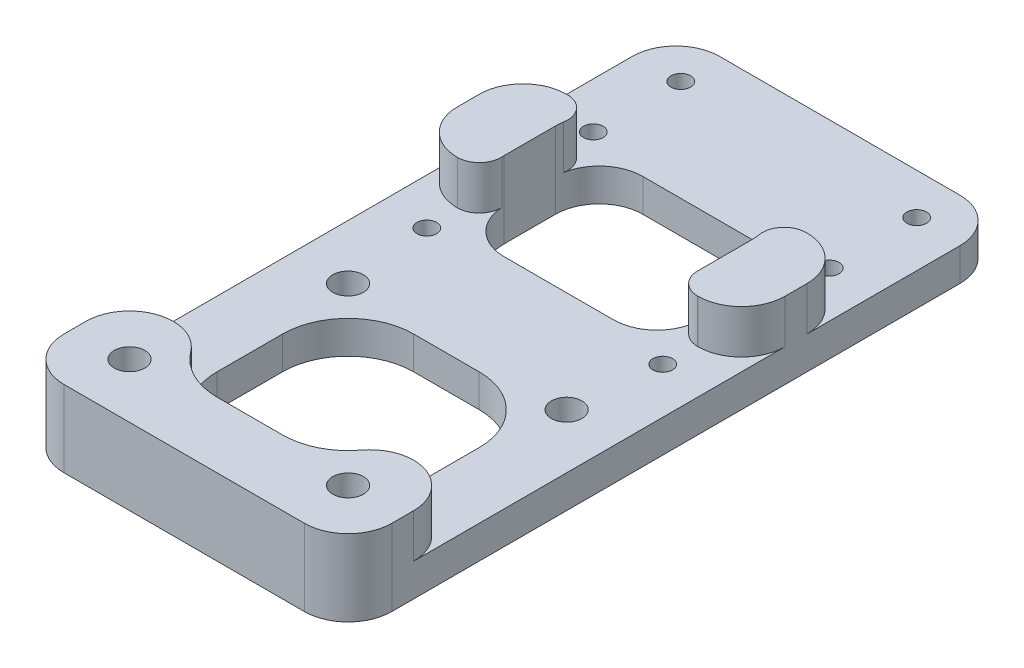
from build123d import *

# Parameters (mm, degrees)
SKETCH1_W               = 30
SKETCH1_H               = 30
BOSS_EXTRUDE1_DEPTH     = 3
SKETCH3_W               = 30
SKETCH3_H               = 30
BOSS_EXTRUDE2_DEPTH     = 3
SKETCH4_W               = 30
SKETCH4_H               = 10
BOSS_EXTRUDE3_DEPTH     = 4
CUT_EXTRUDE1_DEPTH      = 48.602520942
CUT_EXTRUDE1_DEPTH_BACK = 48.602520942
SKETCH2_R               = 1.4
SKETCH2_R_2             = 0.9
FILLET1_R               = 4
FILLET2_R               = 2


with BuildPart() as part:
    # Sketch1 → Boss-Extrude1 (new body)
    with BuildSketch(Plane(origin=(0, 0, 0), x_dir=(1, 0, 0), z_dir=(0, 1, 0))):
        Rectangle(SKETCH1_W, SKETCH1_H)
    extrude(amount=BOSS_EXTRUDE1_DEPTH)

    # Sketch3 → Boss-Extrude2 (add)
    with BuildSketch(Plane(origin=(0, 3, 0), x_dir=(1, 0, 0), z_dir=(0, 1, 0))):
        with Locations((0, 30)):
            Rectangle(SKETCH3_W, SKETCH3_H)
    extrude(amount=-BOSS_EXTRUDE2_DEPTH)

    # Sketch4 → Boss-Extrude3 (add)
    with BuildSketch(Plane(origin=(0, 3, 0), x_dir=(1, 0, 0), z_dir=(0, 1, 0))):
        with Locations((0, -10)):
            Rectangle(SKETCH4_W, SKETCH4_H)
        with Locations((0, 26)):
            Rectangle(SKETCH4_W, SKETCH4_H)
    extrude(amount=BOSS_EXTRUDE3_DEPTH)

    # Sketch2 → Cut-Extrude1 (cut, two sides: drawn at the far end of the back side and taken through both)
    with BuildSketch(Plane(origin=(0, 3, 0), x_dir=(1, 0, 0), z_dir=(0, 1, 0)).offset(-CUT_EXTRUDE1_DEPTH_BACK)):
        with Locations(Location((-10, -10, 0), (0, 0, 270))):
            Circle(SKETCH2_R)
        with Locations(Location((10, -10, 0), (0, 0, 270))):
            Circle(SKETCH2_R)
        with Locations(Location((10, 10, 0), (0, 0, 90))):
            Circle(SKETCH2_R)
        with Locations(Location((-10, 10, 0), (0, 0, 90))):
            Circle(SKETCH2_R)
        with Locations(Location((-10.795, 33.24, 0), (0, 0, 90))):
            Circle(SKETCH2_R_2)
        with Locations(Location((10.795, 33.24, 0), (0, 0, 90))):
            Circle(SKETCH2_R_2)
        with Locations(Location((10.795, 18, 0), (0, 0, 90))):
            Circle(SKETCH2_R_2)
        with Locations(Location((-10.795, 18, 0), (0, 0, 90))):
            Circle(SKETCH2_R_2)
        with Locations(Location((-10.795, 41.24, 0), (0, 0, 90))):
            Circle(SKETCH2_R_2)
        with Locations(Location((10.795, 41.24, 0), (0, 0, 90))):
            Circle(SKETCH2_R_2)
        with BuildLine():
            Line((-3, -9), (3, -9))
            ThreePointArc((3, -9), (7.242640687, -7.242640687), (9, -3))
            Line((9, -3), (9, 3))
            ThreePointArc((9, 3), (7.242640687, 7.242640687), (3, 9))
            Line((3, 9), (-3, 9))
            ThreePointArc((-3, 9), (-7.242640687, 7.242640687), (-9, 3))
            Line((-9, 3), (-9, -3))
            ThreePointArc((-9, -3), (-7.242640687, -7.242640687), (-3, -9))
        make_face()
        with BuildLine():
            Line((-5, 19.267058824), (5, 19.267058824))
            ThreePointArc((5, 19.267058824), (7.828427125, 20.438631699), (9, 23.267058824))
            Line((9, 23.267058824), (9, 27.972941176))
            ThreePointArc((9, 27.972941176), (7.828427125, 30.801368301), (5, 31.972941176))
            Line((5, 31.972941176), (-5, 31.972941176))
            ThreePointArc((-5, 31.972941176), (-7.828427125, 30.801368301), (-9, 27.972941176))
            Line((-9, 27.972941176), (-9, 23.267058824))
            ThreePointArc((-9, 23.267058824), (-7.828427125, 20.438631699), (-5, 19.267058824))
        make_face()
    extrude(amount=CUT_EXTRUDE1_DEPTH + CUT_EXTRUDE1_DEPTH_BACK, mode=Mode.SUBTRACT)

    # Fillet1
    fillet1_edges = [part.edges().sort_by_distance(p)[0] for p in [
        (-15, 1.5, -45),
        (15, 1.5, -45),
        (15, 3.5, 15),
        (-15, 3.5, 15),
        (15, 5, 5),
        (8.656854249, 5, 5),
        (-8.656854249, 5, 5),
        (-15, 5, 5),
        (15, 5, -21),
        (15, 5, -31),
        (-15, 5, -21),
        (-15, 5, -31),
    ]]
    fillet(fillet1_edges, radius=FILLET1_R - 0.0001)  # a hair under: the kernel refuses the full size

    # Fillet2
    fillet2_edges = [part.edges().sort_by_distance(p)[0] for p in [
        (-8.29551882, 5, -21),
        (8.29551882, 5, -21),
        (7.614749487, 5, -31),
        (-7.614749487, 5, -31),
    ]]
    fillet(fillet2_edges, radius=FILLET2_R)


solid = part.part
